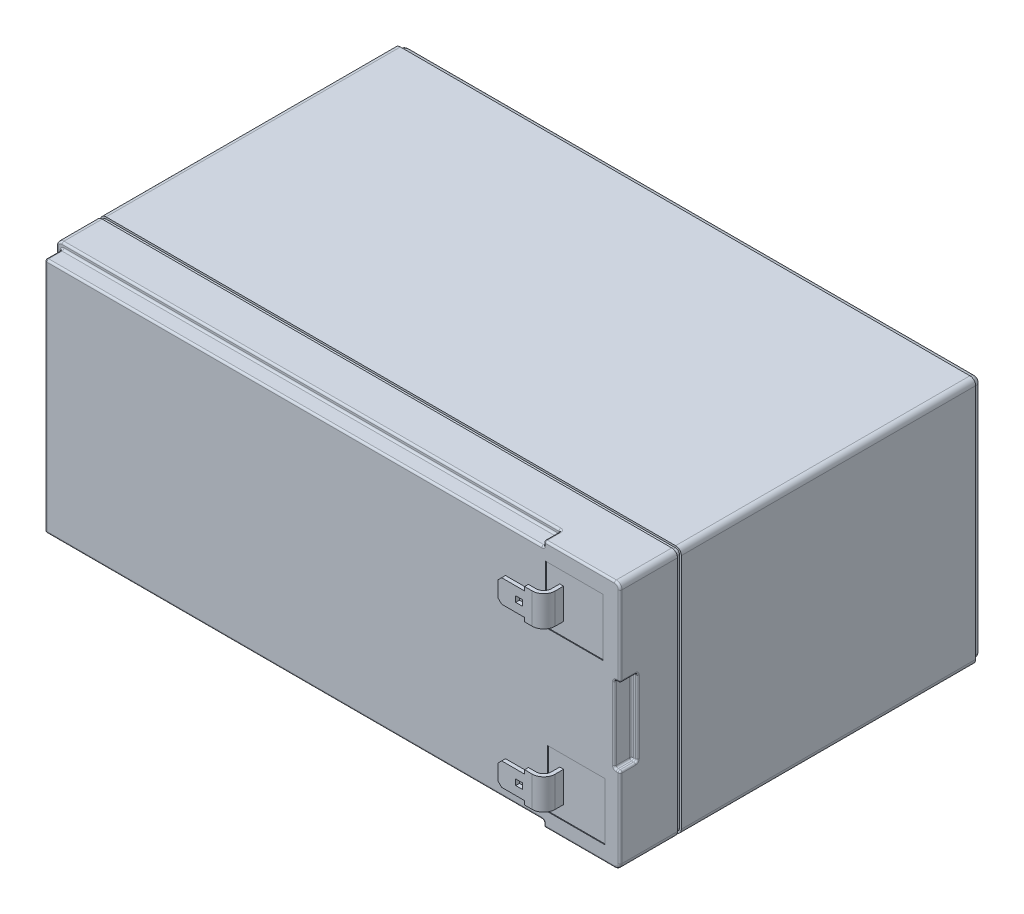
from build123d import *

# Parameters (mm, degrees)
ESQUISSE1_W                             = 152
ESQUISSE1_H                             = 65
EXTRUSION1_DEPTH                        = 95
ESQUISSE2_W                             = 152
ESQUISSE2_H                             = 65
ESQUISSE2_W_2                           = 151
ESQUISSE2_H_2                           = 64
ENL_V_MAT_EXTRU_1_DEPTH                 = 2
CONG_1_R                                = 1.5
CONG_2_R                                = 1.5
ENL_V_START                             = -1
ENL_V_MAT_EXTRU_2_DEPTH                 = 1
ENL_V_START_2                           = -4.5
ESQUISSE4_W                             = 6.55328375
ESQUISSE4_H                             = 20
ENL_V_MAT_EXTRU_3_DEPTH                 = 4.5
CONG_3_R                                = 0.5
ESQUISSE5_W                             = 15
ESQUISSE5_H                             = 15
ENL_V_MAT_EXTRU_4_DEPTH                 = 0.2
ESQUISSE6_W                             = 15
ESQUISSE6_H                             = 15
ENL_V_MAT_EXTRU_5_DEPTH                 = 0.2
ESQUISSE7_W                             = 1
ESQUISSE7_H                             = 8
ESQUISSE9_W                             = 7
ESQUISSE9_H                             = 1
ESQUISSE9_W_2                           = 1.820752184
ESQUISSE9_H_2                           = 1.5
ENL_V_MAT_EXTRU_6_DEPTH                 = 1
CHANFREIN1_SIZE                         = 1
R_P_TITION_LIN_AIRE1_COUNT              = 2
R_P_TITION_LIN_AIRE1_PITCH              = 41.5
CHANFREIN1_OF_R_P_TITION_LIN_AIRE1_SIZE = 1


with BuildPart() as part:
    # Esquisse1 → Extrusion1 (new body)
    with BuildSketch(Plane.XY):
        with Locations((76, 32.5)):
            Rectangle(ESQUISSE1_W, ESQUISSE1_H)
    extrude(amount=EXTRUSION1_DEPTH)

    # Esquisse2 → Enlèv. mat.-Extru.1 (cut)
    with BuildSketch(Plane(origin=(0, 0, 0), x_dir=(-1, 0, 0), z_dir=(0, 0, -1))):
        with Locations((-76, 32.5)):
            Rectangle(ESQUISSE2_W, ESQUISSE2_H)
        with Locations((-76, 32.5)):
            Rectangle(ESQUISSE2_W_2, ESQUISSE2_H_2, mode=Mode.SUBTRACT)
    extrude(amount=-ENL_V_MAT_EXTRU_1_DEPTH, mode=Mode.SUBTRACT)

    # Congé1
    cong_1_edges = [part.edges().sort_by_distance(p)[0] for p in [
        (76, 0.5, 0),
        (151.5, 32.5, 0),
        (76, 64.5, 0),
        (0.5, 32.5, 0),
    ]]
    fillet(cong_1_edges, radius=CONG_1_R)

    # Congé2
    # the kernel refuses this fillet: 1.5 mm, written as the material it takes off along each edge
    with BuildSketch(Plane(origin=(2, 2, 1.5), x_dir=(-1, 0, 0), z_dir=(0, -1, 0))) as cong_2_piece_1_section:
        Polygon((0, 0), (CONG_2_R, 0), (CONG_2_R, CONG_2_R), (0, CONG_2_R), align=None)
    cong_2_piece_1 = extrude(amount=CONG_2_R, mode=Mode.PRIVATE)
    cong_2_piece_1 = cong_2_piece_1 - Plane(origin=(2, 2, 1.5), x_dir=(0.7071067811865475, 0, 0.7071067811865475), z_dir=(0, -1, 0)) * Sphere(CONG_2_R, mode=Mode.PRIVATE)
    add(cong_2_piece_1, mode=Mode.SUBTRACT)
    with BuildSketch(Plane(origin=(150, 2, 1.5), x_dir=(1, 0, 0), z_dir=(0, -1, 0))) as cong_2_piece_2_section:
        Polygon((0, 0), (CONG_2_R, 0), (CONG_2_R, -CONG_2_R), (0, -CONG_2_R), align=None)
    cong_2_piece_2 = extrude(amount=CONG_2_R, mode=Mode.PRIVATE)
    cong_2_piece_2 = cong_2_piece_2 - Plane(origin=(150, 2, 1.5), x_dir=(-0.7071067811865475, 0, 0.7071067811865475), z_dir=(0, -1, 0)) * Sphere(CONG_2_R, mode=Mode.PRIVATE)
    add(cong_2_piece_2, mode=Mode.SUBTRACT)
    with BuildSketch(Plane(origin=(2, 63, 1.5), x_dir=(0, 1, 0), z_dir=(-1, 0, 0))) as cong_2_piece_3_section:
        Polygon((0, 0), (CONG_2_R, 0), (CONG_2_R, CONG_2_R), (0, CONG_2_R), align=None)
    cong_2_piece_3 = extrude(amount=CONG_2_R, mode=Mode.PRIVATE)
    cong_2_piece_3 = cong_2_piece_3 - Plane(origin=(2, 63, 1.5), x_dir=(0, -0.7071067811865475, 0.7071067811865475), z_dir=(-1, 0, 0)) * Sphere(CONG_2_R, mode=Mode.PRIVATE)
    add(cong_2_piece_3, mode=Mode.SUBTRACT)
    with BuildSketch(Plane(origin=(150, 63, 1.5), x_dir=(0, 1, 0), z_dir=(1, 0, 0))) as cong_2_piece_4_section:
        Polygon((0, 0), (CONG_2_R, 0), (CONG_2_R, -CONG_2_R), (0, -CONG_2_R), align=None)
    cong_2_piece_4 = extrude(amount=CONG_2_R, mode=Mode.PRIVATE)
    cong_2_piece_4 = cong_2_piece_4 - Plane(origin=(150, 63, 1.5), x_dir=(0, -0.7071067811865475, 0.7071067811865475), z_dir=(1, 0, 0)) * Sphere(CONG_2_R, mode=Mode.PRIVATE)
    add(cong_2_piece_4, mode=Mode.SUBTRACT)
    with BuildSketch(Plane(origin=(151.5, 0.5, 1.5), x_dir=(-1, 0, 0), z_dir=(0, 0, 1)), Plane(origin=(151.5, 64.5, 1.5), x_dir=(0, -1, 0), z_dir=(0, 0, 1))) as cong_2_piece_5:
        with BuildLine():
            CenterArc((CONG_2_R, -CONG_2_R), CONG_2_R, 90, 90)
            Line((0, -CONG_2_R), (0, 0))
            Line((0, 0), (CONG_2_R, 0))
        make_face()
    extrude(amount=0.5, mode=Mode.SUBTRACT)
    with BuildSketch(Plane(origin=(0.5, 64.5, 1.5), x_dir=(0, -1, 0), z_dir=(0, 0, 1)), Plane(origin=(0.5, 0.5, 1.5), x_dir=(1, 0, 0), z_dir=(0, 0, 1))) as cong_2_piece_6:
        with BuildLine():
            CenterArc((CONG_2_R, CONG_2_R), CONG_2_R, 180, 90)
            Line((0, CONG_2_R), (0, 0))
            Line((0, 0), (CONG_2_R, 0))
        make_face()
    extrude(amount=0.5, mode=Mode.SUBTRACT)
    with BuildSketch(Plane(origin=(0, 65, -1.75), x_dir=(0, -1, 0), z_dir=(0, 0, 1)), Plane(origin=(152, 65, -1.75), x_dir=(-1, 0, 0), z_dir=(0, 0, 1)), Plane(origin=(152, 0, -1.75), x_dir=(0, 1, 0), z_dir=(0, 0, 1))) as cong_2_piece_7:
        with BuildLine():
            CenterArc((CONG_2_R, CONG_2_R), CONG_2_R, 180, 90)
            Line((0, CONG_2_R), (0, 0))
            Line((0, 0), (CONG_2_R, 0))
        make_face()
    extrude(amount=100.5, mode=Mode.SUBTRACT)
    with BuildSketch(Plane(origin=(0, 0, -1.75), x_dir=(0, 1, 0), z_dir=(0, 0, 1))) as cong_2_piece_8:
        with BuildLine():
            CenterArc((CONG_2_R, -CONG_2_R), CONG_2_R, 90, 90)
            Line((0, -CONG_2_R), (0, 0))
            Line((0, 0), (CONG_2_R, 0))
        make_face()
    extrude(amount=100.5, mode=Mode.SUBTRACT)

    # Esquisse3 → Enlèv. mat.-Extru.2 (cut)
    with BuildSketch(Plane.XY.offset(80).offset(ENL_V_START)):
        with BuildLine():
            Line((152, 1.5), (152, 63.5))
            ThreePointArc((152, 63.5), (151.560660172, 64.560660172), (150.5, 65))
            Line((150.5, 65), (1.5, 65))
            ThreePointArc((1.5, 65), (0.439339828, 64.560660172), (0, 63.5))
            Line((0, 63.5), (0, 1.5))
            ThreePointArc((0, 1.5), (0.439339828, 0.439339828), (1.5, 0))
            Line((1.5, 0), (150.5, 0))
            ThreePointArc((150.5, 0), (151.560660172, 0.439339828), (152, 1.5))
        make_face()
        with BuildLine():
            Line((151.5, 1.5), (151.5, 63.5))
            ThreePointArc((151.5, 63.5), (151.207106781, 64.207106781), (150.5, 64.5))
            Line((150.5, 64.5), (1.5, 64.5))
            ThreePointArc((1.5, 64.5), (0.792893219, 64.207106781), (0.5, 63.5))
            Line((0.5, 63.5), (0.5, 1.5))
            ThreePointArc((0.5, 1.5), (0.792893219, 0.792893219), (1.5, 0.5))
            Line((1.5, 0.5), (150.5, 0.5))
            ThreePointArc((150.5, 0.5), (151.207106781, 0.792893219), (151.5, 1.5))
        make_face(mode=Mode.SUBTRACT)
    extrude(amount=ENL_V_MAT_EXTRU_2_DEPTH, mode=Mode.SUBTRACT)

    # Esquisse4 → Enlèv. mat.-Extru.3 (cut)
    with BuildSketch(Plane.XY.offset(95).offset(ENL_V_START_2)):
        with Locations((153.776641875, 32.5)):
            Rectangle(ESQUISSE4_W, ESQUISSE4_H)
        with BuildLine():
            Line((132, 63.5), (1.5, 63.5))
            Line((1.5, 63.5), (1.5, 1.5))
            Line((1.5, 1.5), (132, 1.5))
            Line((132, 1.5), (132, 0))
            Line((132, 0), (1.5, 0))
            ThreePointArc((1.5, 0), (0.439339828, 0.439339828), (0, 1.5))
            Line((0, 1.5), (0, 63.5))
            ThreePointArc((0, 63.5), (0.439339828, 64.560660172), (1.5, 65))
            Line((1.5, 65), (132, 65))
            Line((132, 65), (132, 63.5))
        make_face()
    extrude(amount=ENL_V_MAT_EXTRU_3_DEPTH, mode=Mode.SUBTRACT)

    # Congé3
    cong_3_edges = [part.edges().sort_by_distance(p)[0] for p in [
        (141.25, 0, 95),
        (0.439339828, 64.560660172, 90.5),
        (66.75, 65, 90.5),
        (132, 64.25, 90.5),
        (132, 65, 92.75),
        (66.75, 63.5, 90.5),
        (132, 63.5, 92.75),
        (1.5, 32.5, 90.5),
        (1.5, 63.5, 92.75),
        (66.75, 1.5, 90.5),
        (1.5, 1.5, 92.75),
        (132, 0.75, 90.5),
        (132, 1.5, 92.75),
        (66.75, 0, 90.5),
        (132, 0, 92.75),
        (0.439339828, 0.439339828, 90.5),
        (0, 32.5, 90.5),
        (132, 0.75, 95),
        (66.75, 1.5, 95),
        (1.5, 32.5, 95),
        (66.75, 63.5, 95),
        (132, 64.25, 95),
        (152, 53, 95),
        (152, 32.5, 90.5),
        (152, 22.5, 92.75),
        (152, 42.5, 92.75),
        (151.25, 42.5, 90.5),
        (150.5, 42.5, 92.75),
        (151.25, 22.5, 90.5),
        (151.25, 42.5, 95),
        (150.5, 32.5, 95),
        (151.25, 22.5, 95),
        (150.5, 32.5, 90.5),
        (150.5, 22.5, 92.75),
        (141.25, 65, 95),
        (152, 12, 95),
        (151.560660172, 0.439339828, 95),
        (151.560660172, 64.560660172, 95),
    ]]
    fillet(cong_3_edges, radius=CONG_3_R)

    # Esquisse5 → Enlèv. mat.-Extru.4 (cut)
    with BuildSketch(Plane.XY.offset(95)):
        with Locations((140.5, 11.5)):
            Rectangle(ESQUISSE5_W, ESQUISSE5_H)
    extrude(amount=-ENL_V_MAT_EXTRU_4_DEPTH, mode=Mode.SUBTRACT)

    # Esquisse6 → Enlèv. mat.-Extru.5 (cut)
    with BuildSketch(Plane.XY.offset(95)):
        with Locations((140, 53)):
            Rectangle(ESQUISSE6_W, ESQUISSE6_H)
    extrude(amount=-ENL_V_MAT_EXTRU_5_DEPTH, mode=Mode.SUBTRACT)

    # Balayage1: sweep along a path in Esquisse8
    with BuildLine(Plane.XZ.offset(-7.5)) as balayage1_path:
        Line((136, 94.8), (136, 97))
        ThreePointArc((136, 97), (135.414213562, 98.414213562), (134, 99))
        Line((134, 99), (125, 99))
    # Esquisse7 → Balayage1 (sweep)
    with BuildSketch(Plane.XY.offset(94.8)):
        with Locations((136.5, 11.5)):
            Rectangle(ESQUISSE7_W, ESQUISSE7_H)
    balayage1 = sweep(path=balayage1_path.line)

    # Esquisse9 → Enlèv. mat.-Extru.6 (cut)
    with BuildSketch(Plane.XY.offset(100)):
        with Locations((128.5, 8)):
            Rectangle(ESQUISSE9_W, ESQUISSE9_H)
        with Locations((128.5, 15)):
            Rectangle(ESQUISSE9_W, ESQUISSE9_H)
        with Locations((130.588145488, 11.5)):
            Rectangle(ESQUISSE9_W_2, ESQUISSE9_H_2)
    enl_v_mat_extru_6 = extrude(amount=-ENL_V_MAT_EXTRU_6_DEPTH, mode=Mode.SUBTRACT)

    # Chanfrein1
    chanfrein1_edges = [part.edges().sort_by_distance(p)[0] for p in [
        (125, 8.5, 99.5),
        (125, 14.5, 99.5),
    ]]
    chamfer(chanfrein1_edges, length=CHANFREIN1_SIZE)

    # Répétition linéaire1: Balayage1, Enlèv. mat.-Extru.6 ×2
    with Locations(*[(0, i * R_P_TITION_LIN_AIRE1_PITCH, 0) for i in range(1, R_P_TITION_LIN_AIRE1_COUNT)]):
        add(balayage1)
        add(enl_v_mat_extru_6, mode=Mode.SUBTRACT)

    # Chanfrein1 of Répétition linéaire1
    chanfrein1_of_r_p_tition_lin_aire1_edges = [part.edges().sort_by_distance(p)[0] for p in [
        (125, 50, 99.5),
        (125, 56, 99.5),
    ]]
    chamfer(chanfrein1_of_r_p_tition_lin_aire1_edges, length=CHANFREIN1_OF_R_P_TITION_LIN_AIRE1_SIZE)


solid = part.part
